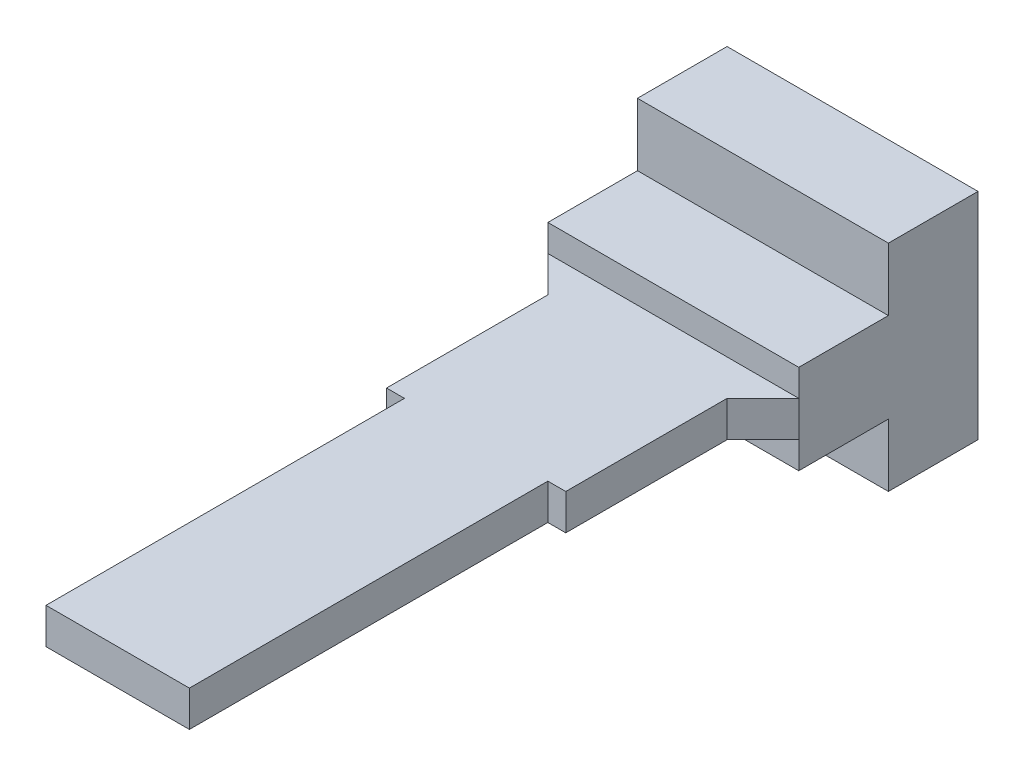
from build123d import *

# Parameters (mm, degrees)
SKETCH_1_W      = 7
SKETCH_1_H      = 6
EXTRUDE_1_DEPTH = 2.5
SKETCH_2_W      = 7
SKETCH_2_H      = 2.5
EXTRUDE_2_DEPTH = 2.5
SKETCH_3_W      = 7
SKETCH_3_H      = 1
EXTRUDE_3_DEPTH = 1
SKETCH_4_W      = 5
SKETCH_4_H      = 1
EXTRUDE_4_DEPTH = 4.5
SKETCH_5_W      = 4
SKETCH_5_H      = 1
EXTRUDE_5_DEPTH = 10
CHAMFER_1_SIZE  = 1


with BuildPart() as part:
    # 스케치1 → 보스-돌출1 (new body)
    with BuildSketch(Plane.XY):
        Rectangle(SKETCH_1_W, SKETCH_1_H)
    extrude(amount=EXTRUDE_1_DEPTH)

    # 스케치2 → 보스-돌출2 (add)
    with BuildSketch(Plane.XY.offset(2.5)):
        Rectangle(SKETCH_2_W, SKETCH_2_H)
    extrude(amount=EXTRUDE_2_DEPTH)

    # 스케치3 → 보스-돌출3 (add)
    with BuildSketch(Plane.XY.offset(5)):
        Rectangle(SKETCH_3_W, SKETCH_3_H)
    extrude(amount=EXTRUDE_3_DEPTH)

    # 스케치4 → 보스-돌출4 (add)
    with BuildSketch(Plane.XY.offset(6)):
        Rectangle(SKETCH_4_W, SKETCH_4_H)
    extrude(amount=EXTRUDE_4_DEPTH)

    # 스케치5 → 보스-돌출5 (add)
    with BuildSketch(Plane.XY.offset(10.5)):
        Rectangle(SKETCH_5_W, SKETCH_5_H)
    extrude(amount=EXTRUDE_5_DEPTH)

    # 모따기1
    chamfer_1_edges = [part.edges().sort_by_distance(p)[0] for p in [
        (3.5, 0, 6),
        (-3.5, 0, 6),
    ]]
    chamfer(chamfer_1_edges, length=CHAMFER_1_SIZE - 0.0001)  # a hair under: the kernel refuses the full size


solid = part.part
